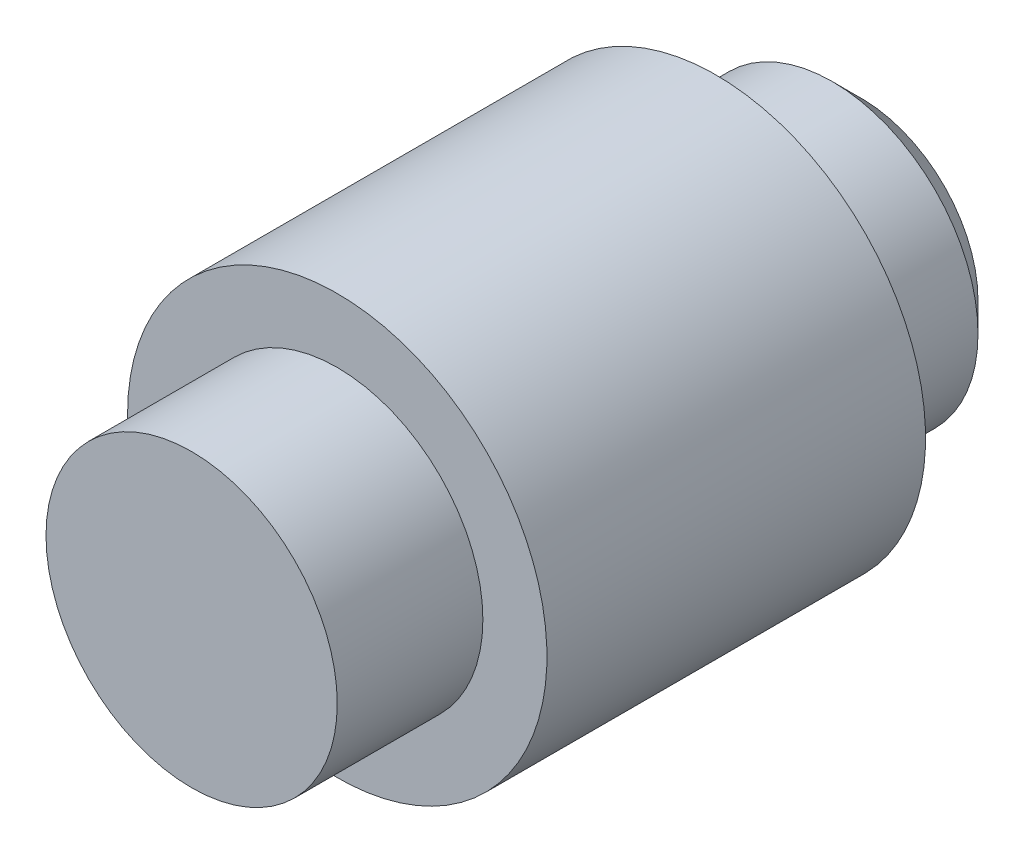
from build123d import *

# Parameters (mm, degrees)
SKETCH3_R           = 3.6
BOSS_EXTRUDE1_DEPTH = 6.5
SKETCH4_R           = 2.5
BOSS_EXTRUDE2_DEPTH = 2.5
BOSS_EXTRUDE3_START = 2.5
SKETCH5_R           = 2.5
BOSS_EXTRUDE3_DEPTH = 2.5
CHAMFER1_SIZE       = 0.5


with BuildPart() as part:
    # Sketch3 → Boss-Extrude1 (new body)
    with BuildSketch(Plane.XY):
        Circle(SKETCH3_R)
    extrude(amount=BOSS_EXTRUDE1_DEPTH)

    # Sketch4 → Boss-Extrude2 (add)
    with BuildSketch(Plane.XY):
        Circle(SKETCH4_R)
    extrude(amount=-BOSS_EXTRUDE2_DEPTH)

    # Sketch5 → Boss-Extrude3 (add)
    with BuildSketch(Plane.XY.offset(6.5).offset(BOSS_EXTRUDE3_START)):
        Circle(SKETCH5_R)
    extrude(amount=-BOSS_EXTRUDE3_DEPTH)

    # Chamfer1
    chamfer1_edges = [part.edges().sort_by_distance(p)[0] for p in [
        (-2.5, 0, -2.5),
    ]]
    chamfer(chamfer1_edges, length=CHAMFER1_SIZE)


solid = part.part
